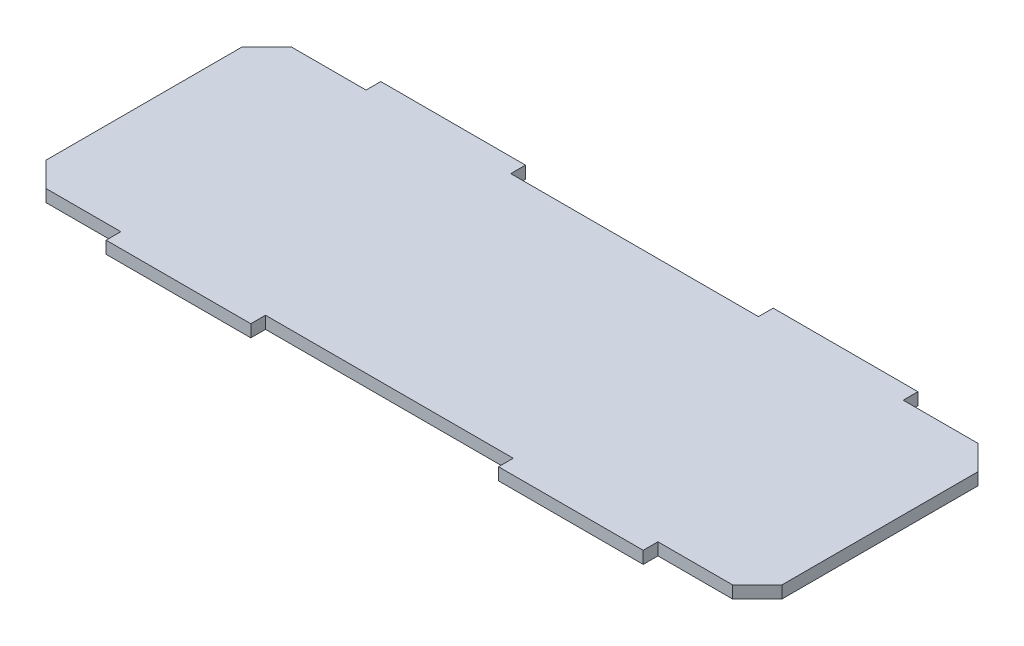
from build123d import *

# Parameters (mm, degrees)
SALIENTE_EXTRUIR1_DEPTH = 2.5


with BuildPart() as part:
    # Croquis1 → Saliente-Extruir1 (new body)
    with BuildSketch(Plane(origin=(0, 0, 0), x_dir=(1, 0, 0), z_dir=(0, 1, 0))):
        Polygon((-70, -25), (-54.75, -25), (-54.75, -28), (-25.25, -28), (-25.25, -25), (25.25, -25), (25.25, -28), (54.75, -28), (54.75, -25), (70, -25), (75, -20), (75, 20), (70, 25), (54.75, 25), (54.75, 28), (25.25, 28), (25.25, 25), (-25.25, 25), (-25.25, 28), (-54.75, 28), (-54.75, 25), (-70, 25), (-75, 20), (-75, -20), align=None)
    extrude(amount=SALIENTE_EXTRUIR1_DEPTH)


solid = part.part
